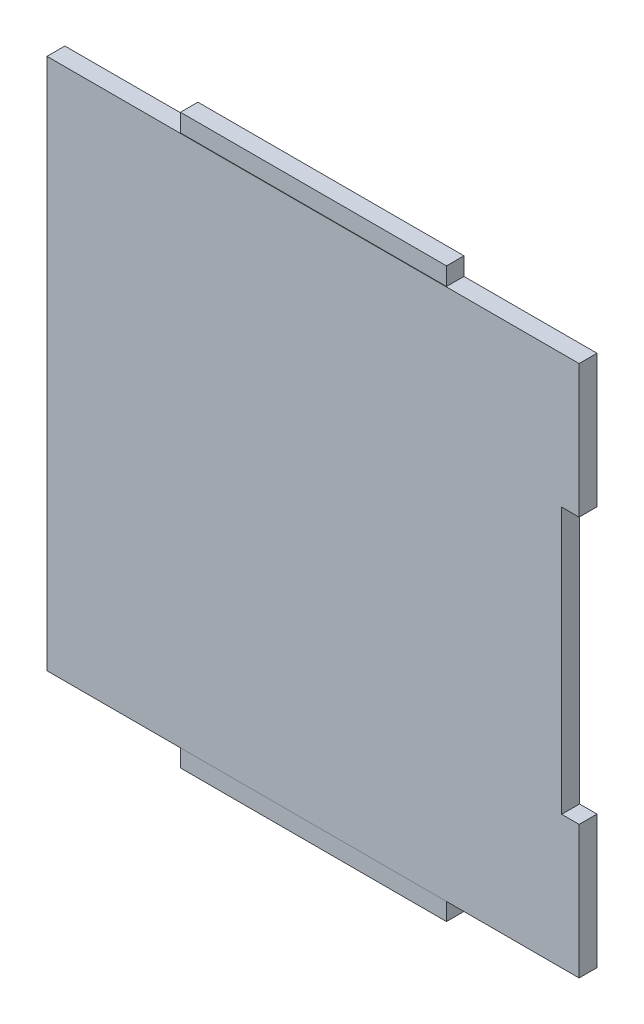
from build123d import *

# Parameters (mm, degrees)
SKETCH1_W           = 100
SKETCH1_H           = 100
BOSS_EXTRUDE1_DEPTH = 3.36
SKETCH6_W           = 3.28
SKETCH6_H           = 50
CUT_EXTRUDE1_DEPTH  = 3.36
SKETCH8_W           = 50
SKETCH8_H           = 3.36
BOSS_EXTRUDE4_DEPTH = 3.28


with BuildPart() as part:
    # Sketch1 → Boss-Extrude1 (new body)
    with BuildSketch(Plane.XY):
        Rectangle(SKETCH1_W, SKETCH1_H)
    extrude(amount=BOSS_EXTRUDE1_DEPTH)

    # Sketch6 → Cut-Extrude1 (cut)
    with BuildSketch(Plane(origin=(0, 0, 0), x_dir=(-1, 0, 0), z_dir=(0, 0, -1))):
        with Locations((-48.36, 0)):
            Rectangle(SKETCH6_W, SKETCH6_H)
    extrude(amount=-CUT_EXTRUDE1_DEPTH, mode=Mode.SUBTRACT)

    # Sketch8 → Boss-Extrude4 (add)
    with BuildSketch(Plane(origin=(0, 0, 0), x_dir=(-1, 0, 0), z_dir=(0, 0, -1))):
        with Locations((0, 51.68)):
            Rectangle(SKETCH8_W, SKETCH8_H)
    boss_extrude4 = extrude(amount=-BOSS_EXTRUDE4_DEPTH)

    # Mirror4: Boss-Extrude4 across plane
    add(boss_extrude4.mirror(Plane.ZX))


solid = part.part
